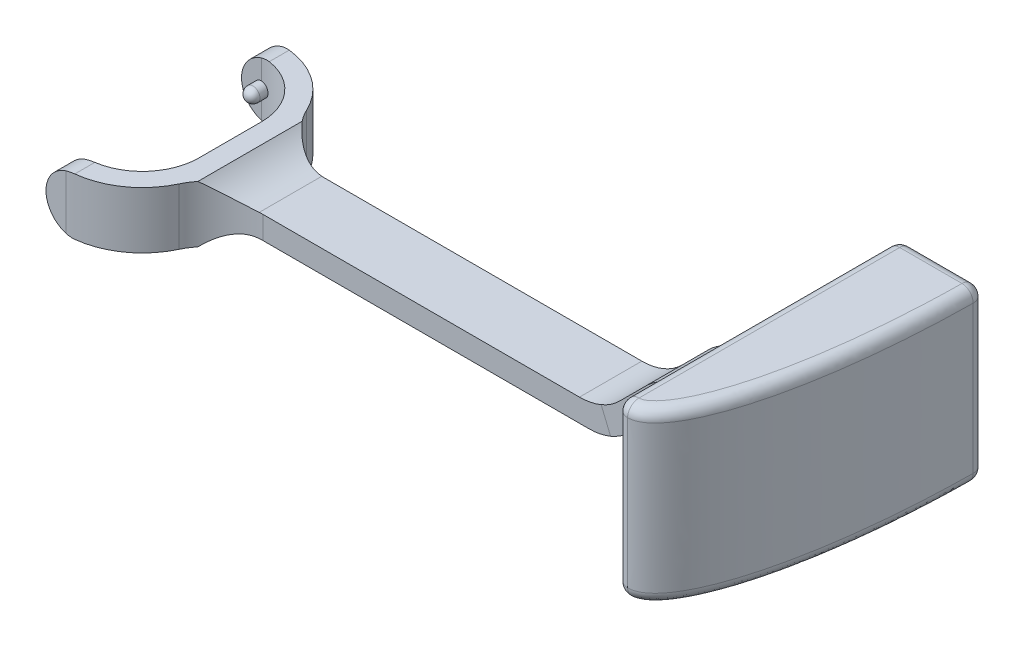
from build123d import *

# Parameters (mm, degrees)
SKETCH1_W           = 11
SKETCH1_H           = 4
BOSS_EXTRUDE1_DEPTH = 62.5
SKETCH14_W          = 11
SKETCH14_H          = 4
FILLET1_R           = 10
SKETCH16_W          = 50
SKETCH16_H          = 30
BOSS_EXTRUDE2_DEPTH = 15
FILLET2_SIZE        = 13
FILLET2_SIZE_2      = 50
FILLET3_R           = 2
BOSS_EXTRUDE3_START = -7
BOSS_EXTRUDE3_DEPTH = 10
FILLET4_R           = 10
FILLET5_START       = -7
FILLET5_DEPTH       = 10
FILLET5_START_2     = -16.744680851
FILLET5_2_DEPTH     = 22.489361702
FILLET6_R           = 5
SKETCH18_R          = 1.25
BOSS_EXTRUDE4_DEPTH = 1.5
BOSS_EXTRUDE5_START = 1.5
SKETCH19_R          = 1.25
BOSS_EXTRUDE5_DEPTH = 1.5
REVOLVE9_ANGLE      = 180
REVOLVE10_ANGLE     = 180


with BuildPart() as part:
    # Sketch1 → Boss-Extrude1 (new body)
    with BuildSketch(Plane(origin=(0, 0, 0), x_dir=(0, 0, -1), z_dir=(1, 0, 0))):
        with Locations((5.5, -2)):
            Rectangle(SKETCH1_W, SKETCH1_H)
    extrude(amount=BOSS_EXTRUDE1_DEPTH)

    # Sweep3: sweep along a curve in space
    with BuildLine() as sweep3_path:
        Line((62.5, -3, -5.5), (72.5, -3, -5.5))
        Line((72.5, -3, -5.5), (83.106601718, 7.606601718, -5.5))
        Line((83.106601718, 7.606601718, -5.5), (93.106601718, 7.606601718, -5.5))
    # Sketch14 → Sweep3 (sweep)
    with BuildSketch(Plane(origin=(62.5, 0, 0), x_dir=(0, 0, -1), z_dir=(1, 0, 0))):
        with Locations((5.5, -2)):
            Rectangle(SKETCH14_W, SKETCH14_H)
    sweep(path=sweep3_path.line, transition=Transition.RIGHT)

    # Fillet1
    fillet1_edges = [part.edges().sort_by_distance(p)[0] for p in [
        (81.863961031, 10.606601718, -5.5),
        (83.52081528, 6.606601718, -5.5),
        (71.257359313, 0, -5.5),
        (72.914213562, -4, -5.5),
    ]]
    fillet(fillet1_edges, radius=FILLET1_R)

    # Sketch16 → Boss-Extrude2 (add)
    with BuildSketch(Plane(origin=(93.106601718, 0, 0), x_dir=(0, 0, -1), z_dir=(1, 0, 0))):
        with Locations((5.5, 7.606601718)):
            Rectangle(SKETCH16_W, SKETCH16_H)
    extrude(amount=BOSS_EXTRUDE2_DEPTH)

    # Fillet2
    # a fillet whose section is not a circle: 50, 13 mm, written as the material it takes off along each edge
    with BuildSketch(Plane(origin=(108.106601718, -132.393398282, 19.5), x_dir=(-1, 0, 0), z_dir=(0, 1, 0))) as fillet2_piece_1:
        with BuildLine():
            Bezier((FILLET2_SIZE, 0), (0, 0), (0, -FILLET2_SIZE_2), weights=[1, 0.707106781, 1])
            Line((0, -FILLET2_SIZE_2), (0, 0))
            Line((0, 0), (FILLET2_SIZE, 0))
        make_face()
    extrude(amount=280, mode=Mode.SUBTRACT)

    # Fillet3
    fillet3_edges = [part.edges().sort_by_distance(p)[0] for p in [
        (93.106601718, 8.606601718, -11),
        (93.106601718, 6.606601718, -5.5),
        (93.106601718, 8.606601718, 0),
        (93.106601718, 10.606601718, -5.5),
        (93.106601718, 7.606601718, 19.5),
        (93.106601718, -7.393398282, -5.5),
        (106.077830664, -7.393398282, -3.678175139),
        (93.106601718, 22.606601718, -5.5),
        (106.077830664, 22.606601718, -3.678175139),
        (100.606601718, -7.393398282, -30.5),
        (108.106601718, 7.606601718, -30.5),
        (100.606601718, 22.606601718, -30.5),
        (93.106601718, 7.606601718, -30.5),
    ]]
    fillet(fillet3_edges, radius=FILLET3_R - 0.0001)  # a hair under: the kernel refuses the full size

    # Sketch17 → Boss-Extrude3 (add)
    with BuildSketch(Plane(origin=(0, 0, 0), x_dir=(1, 0, 0), z_dir=(0, 1, 0)).offset(BOSS_EXTRUDE3_START)):
        with BuildLine():
            Line((-10, -10), (-13.5, -10))
            Line((-13.5, -10), (-13.5, -13.5))
            Line((-13.5, -13.5), (-10, -13.5))
            ThreePointArc((-10, -13.5), (-0.454058454, -9.545941546), (3.5, 0))
            Line((3.5, 0), (3.5, 11))
            ThreePointArc((3.5, 11), (-0.454058454, 20.545941546), (-10, 24.5))
            Line((-10, 24.5), (-13.5, 24.5))
            Line((-13.5, 24.5), (-13.5, 21))
            Line((-13.5, 21), (-10, 21))
            ThreePointArc((-10, 21), (-2.928932188, 18.071067812), (0, 11))
            Line((0, 11), (0, 0))
            ThreePointArc((0, 0), (-2.928932188, -7.071067812), (-10, -10))
        make_face()
    extrude(amount=BOSS_EXTRUDE3_DEPTH)

    # Fillet4
    # the kernel refuses this fillet: 10 mm, written as the material it adds along each edge
    with BuildSketch(Plane(origin=(3.5, 0, -11), x_dir=(0, 1, 0), z_dir=(0, 0, 1)), Plane(origin=(3.5, -4, 0), x_dir=(0, -1, 0), z_dir=(0, 0, -1))) as fillet4_piece_1:
        with BuildLine():
            CenterArc((10, -7.141428429), FILLET4_R, 134.427004001, 45.572995999)
            Line((0, -7.141428429), (-0.2, -7.141428429))
            Line((-0.2, -7.141428429), (-0.2, 0))
            Line((-0.2, 0), (0, 0.2))
            ThreePointArc((0, 0.2), (1.5, 0.2), (2.86, 0.142828569))
            Line((2.86, 0.142828569), (3, 0))
        make_face()
    extrude(amount=11)

    # Fillet5: read off the stored shape, not the designer's step
    # Fillet5 outline → Fillet5 (add)
    with BuildSketch(Plane(origin=(0, 0, 0), x_dir=(1, 0, 0), z_dir=(0, 1, 0)).offset(FILLET5_START)):
        with BuildLine():
            ThreePointArc((3.5, 0), (3.175278705, -2.943132864), (2.21673614, -5.744680851))
            ThreePointArc((2.21673614, -5.744680851), (5.906748311, -1.557453243), (11.266170318, 0))
            Line((11.266170318, 0), (3.5, 0))
        make_face()
        with BuildLine():
            Line((3.5, 11), (11.266170318, 11))
            ThreePointArc((11.266170318, 11), (5.906748311, 12.557453243), (2.21673614, 16.744680851))
            ThreePointArc((2.21673614, 16.744680851), (3.175278705, 13.943132864), (3.5, 11))
        make_face()
    extrude(amount=FILLET5_DEPTH)

    # Fillet5 2 outline → Fillet5 2 (cut)
    with BuildSketch(Plane.XY.offset(FILLET5_START_2)):
        with BuildLine():
            ThreePointArc((10.641428429, -4), (6.768445083, -4.780455543), (3.5, -7))
            Line((3.5, -7), (13, -7))
            Line((13, -7), (13, -4))
            Line((13, -4), (10.641428429, -4))
        make_face()
        with BuildLine():
            Line((10.641428429, 0), (13, 0))
            Line((13, 0), (13, 3))
            Line((13, 3), (3.5, 3))
            ThreePointArc((3.5, 3), (6.768445083, 0.780455543), (10.641428429, 0))
        make_face()
    extrude(amount=FILLET5_2_DEPTH, mode=Mode.SUBTRACT)

    # Fillet6
    fillet6_edges = [part.edges().sort_by_distance(p)[0] for p in [
        (-13.5, -7, 11.75),
        (-13.5, 3, 11.75),
        (-13.5, -7, -22.75),
        (-13.5, 3, -22.75),
    ]]
    fillet(fillet6_edges, radius=FILLET6_R - 0.0001)  # a hair under: the kernel refuses the full size

    # Sketch18 → Boss-Extrude4 (add)
    with BuildSketch(Plane.XY.offset(-21)):
        with Locations(Location((-10, -2, 0), (0, 0, 270))):
            Circle(SKETCH18_R)
    extrude(amount=BOSS_EXTRUDE4_DEPTH)

    # Sketch19 → Boss-Extrude5 (add)
    with BuildSketch(Plane(origin=(0, 0, 10), x_dir=(-1, 0, 0), z_dir=(0, 0, -1)).offset(BOSS_EXTRUDE5_START)):
        with Locations(Location((10, -2, 0), (0, 0, 270))):
            Circle(SKETCH19_R)
    extrude(amount=-BOSS_EXTRUDE5_DEPTH)

    # Sketch24 → Revolve9 (revolve)
    with BuildSketch(Plane(origin=(0, 0, 8.5), x_dir=(-1, 0, 0), z_dir=(0, 0, -1))):
        with BuildLine():
            Line((10, -0.75), (10, -3.25))
            ThreePointArc((10, -3.25), (11.25, -2), (10, -0.75))
        make_face()
    revolve(axis=Axis((-10, -0.75, 8.5), (0, -1, 0)), revolution_arc=REVOLVE9_ANGLE)

    # Sketch25 → Revolve10 (revolve)
    with BuildSketch(Plane.XY.offset(-19.5)):
        with BuildLine():
            Line((-10, -0.75), (-10, -3.25))
            ThreePointArc((-10, -3.25), (-11.25, -2), (-10, -0.75))
        make_face()
    revolve(axis=Axis((-10, -0.75, -19.5), (0, 1, 0)), revolution_arc=REVOLVE10_ANGLE)


solid = part.part
